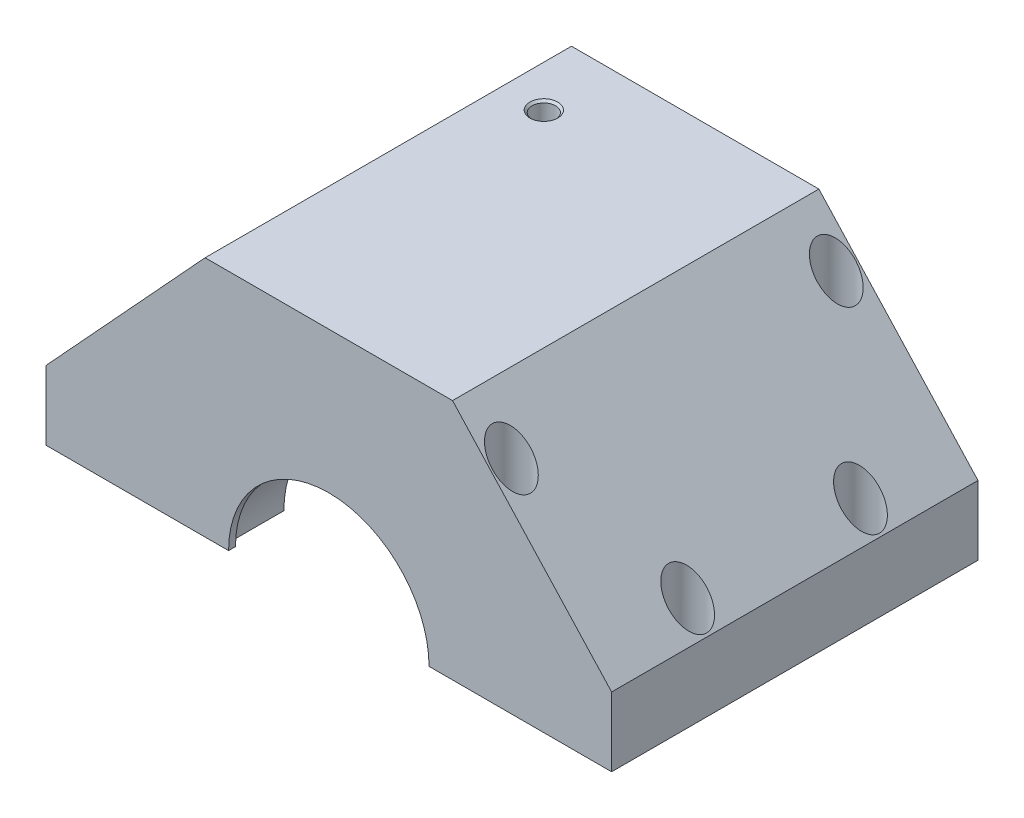
from build123d import *

# Parameters (mm, degrees)
P_IDAT_VYSUNUT_M1_DEPTH                     = 53
ODEBRAT_VYSUNUT_M1_DEPTH                    = 35
V_LCOV_START                                = 38.6
V_LCOV_ZAHLOUBEN_PRO_M6_ROUBY_S_V_2_R       = 5.5
V_LCOV_ZAHLOUBEN_PRO_M6_ROUBY_S_VNIT_DEPTH  = 25.392214676
V_LCOV_ZAHLOUBEN_PRO_M6_ROUBY_S_V_3_O_R     = 3.3
V_LCOV_ZAHLOUBEN_PRO_M6_ROUBY_S_V_3_DEPTH   = 38.6
V_LCOV_START_2                              = 13.6
V_LCOV_ZAHLOUBEN_PRO_M6_ROUBY_S_V_4_O_R     = 5.5
V_LCOV_ZAHLOUBEN_PRO_M6_ROUBY_S_V_4_DEPTH   = 18.891616585
V_LCOV_ZAHLOUBEN_PRO_M6_ROUBY_S_V_5_R       = 3.3
V_LCOV_ZAHLOUBEN_PRO_M6_ROUBY_S_V_4_2_DEPTH = 13.6
M8_Z_VIT1_D                                 = 6.8
M8_Z_VIT1_DEPTH                             = 15
M8_Z_VIT1_CSINK_D                           = 8.05
M8_Z_VIT1_CSINK_ANGLE                       = 90
M8_Z_VIT1_TIP                               = 2.042926105


# Read off the part's stored shape, not the designer's step: Válcové zahloubení pro M6 šrouby s vnitřním šestihranem1, Válcové zahloubení pro M6 šrouby s vnitřním šestihranem2
with BuildPart() as part:
    # Skica1 → Přidat vysunutím1 (new, symmetric)
    with BuildSketch(Plane.XY):
        Polygon((61.822124963, 0), (25.791252921, 60), (-25.791252921, 60), (-61.822124963, 0), align=None)
        Polygon((-25.791252921, 60), (25.791252921, 60), (61.822124963, 0), (81.822124963, 0), (81.822124963, 20), (35.791252921, 70), (-35.791252921, 70), (-81.822124963, 20), (-81.822124963, 0), (-61.822124963, 0), align=None)
    extrude(amount=P_IDAT_VYSUNUT_M1_DEPTH, both=True)

    # Skica1<3> → Odebrat vysunutím1 (cut, symmetric)
    with BuildSketch(Plane.XY):
        Polygon((61.822124963, 0), (25.791252921, 60), (-25.791252921, 60), (-61.822124963, 0), align=None)
    extrude(amount=ODEBRAT_VYSUNUT_M1_DEPTH, both=True, mode=Mode.SUBTRACT)

    # V_lcov_ zahlouben_ pro M6 _rouby s v 2 → V_lcov_ zahlouben_ pro M6 _rouby s vnit (cut)
    with BuildSketch(Plane(origin=(0, 0, 0), x_dir=(1, 0, 0), z_dir=(0, 1, 0)).offset(V_LCOV_START)):
        with Locations((46.822124963, 47)):
            Circle(V_LCOV_ZAHLOUBEN_PRO_M6_ROUBY_S_V_2_R)
        with Locations((-46.822124963, -47)):
            Circle(V_LCOV_ZAHLOUBEN_PRO_M6_ROUBY_S_V_2_R)
        with Locations((46.822124963, -47)):
            Circle(V_LCOV_ZAHLOUBEN_PRO_M6_ROUBY_S_V_2_R)
        with Locations((-46.822124963, 47)):
            Circle(V_LCOV_ZAHLOUBEN_PRO_M6_ROUBY_S_V_2_R)
    extrude(amount=V_LCOV_ZAHLOUBEN_PRO_M6_ROUBY_S_VNIT_DEPTH, mode=Mode.SUBTRACT)

    # V_lcov_ zahlouben_ pro M6 _rouby s v 3 o → V_lcov_ zahlouben_ pro M6 _rouby s v 3 (cut)
    with BuildSketch(Plane(origin=(0, 0, 0), x_dir=(1, 0, 0), z_dir=(0, 1, 0))):
        with Locations((46.822124963, 47)):
            Circle(V_LCOV_ZAHLOUBEN_PRO_M6_ROUBY_S_V_3_O_R)
        with Locations((-46.822124963, -47)):
            Circle(V_LCOV_ZAHLOUBEN_PRO_M6_ROUBY_S_V_3_O_R)
        with Locations((46.822124963, -47)):
            Circle(V_LCOV_ZAHLOUBEN_PRO_M6_ROUBY_S_V_3_O_R)
        with Locations((-46.822124963, 47)):
            Circle(V_LCOV_ZAHLOUBEN_PRO_M6_ROUBY_S_V_3_O_R)
    extrude(amount=V_LCOV_ZAHLOUBEN_PRO_M6_ROUBY_S_V_3_DEPTH, mode=Mode.SUBTRACT)

    # V_lcov_ zahlouben_ pro M6 _rouby s v 4 o → V_lcov_ zahlouben_ pro M6 _rouby s v 4 (cut)
    with BuildSketch(Plane(origin=(0, 0, 0), x_dir=(1, 0, 0), z_dir=(0, 1, 0)).offset(V_LCOV_START_2)):
        with Locations((75.822124963, 25)):
            Circle(V_LCOV_ZAHLOUBEN_PRO_M6_ROUBY_S_V_4_O_R)
        with Locations((-75.822124963, -25)):
            Circle(V_LCOV_ZAHLOUBEN_PRO_M6_ROUBY_S_V_4_O_R)
        with Locations((75.822124963, -25)):
            Circle(V_LCOV_ZAHLOUBEN_PRO_M6_ROUBY_S_V_4_O_R)
        with Locations((-75.822124963, 25)):
            Circle(V_LCOV_ZAHLOUBEN_PRO_M6_ROUBY_S_V_4_O_R)
    extrude(amount=V_LCOV_ZAHLOUBEN_PRO_M6_ROUBY_S_V_4_DEPTH, mode=Mode.SUBTRACT)

    # V_lcov_ zahlouben_ pro M6 _rouby s v 5 → V_lcov_ zahlouben_ pro M6 _rouby s v 4 2 (cut)
    with BuildSketch(Plane(origin=(0, 0, 0), x_dir=(1, 0, 0), z_dir=(0, 1, 0))):
        with Locations((75.822124963, 25)):
            Circle(V_LCOV_ZAHLOUBEN_PRO_M6_ROUBY_S_V_5_R)
        with Locations((-75.822124963, -25)):
            Circle(V_LCOV_ZAHLOUBEN_PRO_M6_ROUBY_S_V_5_R)
        with Locations((75.822124963, -25)):
            Circle(V_LCOV_ZAHLOUBEN_PRO_M6_ROUBY_S_V_5_R)
        with Locations((-75.822124963, 25)):
            Circle(V_LCOV_ZAHLOUBEN_PRO_M6_ROUBY_S_V_5_R)
    extrude(amount=V_LCOV_ZAHLOUBEN_PRO_M6_ROUBY_S_V_4_2_DEPTH, mode=Mode.SUBTRACT)

    # M8 závit1
    with Locations(Plane(origin=(0, 70, 0), x_dir=(1, 0, 0), z_dir=(0, 1, 0))):
        with Locations((-23.791252921, 33)):
            CounterSinkHole(M8_Z_VIT1_D / 2, M8_Z_VIT1_CSINK_D / 2, depth=M8_Z_VIT1_DEPTH, counter_sink_angle=M8_Z_VIT1_CSINK_ANGLE)
            with Locations((0, 0, -(M8_Z_VIT1_DEPTH + M8_Z_VIT1_TIP / 2))):  # 118° drill point
                Cone(0, M8_Z_VIT1_D / 2, M8_Z_VIT1_TIP, mode=Mode.SUBTRACT)

    # Skica12 → Odebrat rotací1 (revolve, cut)
    with BuildSketch(Plane.XZ):
        Polygon((0, 61), (29, 61), (29, 51), (31, 51), (31, -51), (29, -51), (29, -61), (0, -61), align=None)
    revolve(axis=Axis((0, 0, -71.132425853), (0, 0, 1)), mode=Mode.SUBTRACT)


solid = part.part
